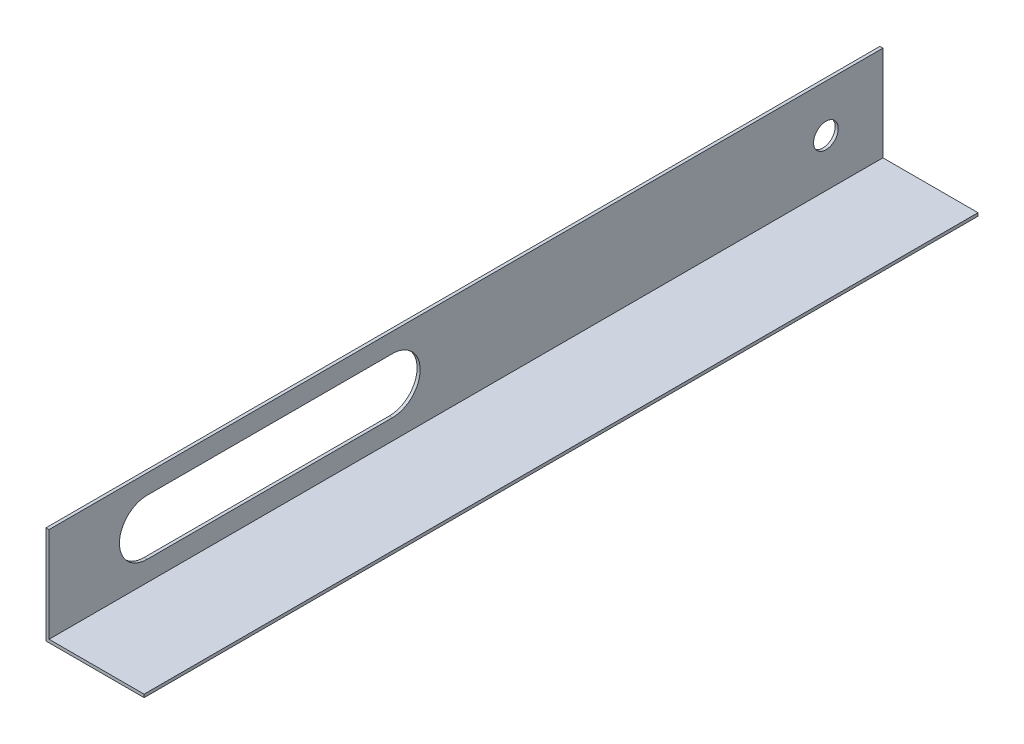
from build123d import *

# Parameters (mm, degrees)
BOSS_EXTRUDE2_DEPTH = 431.8
CUT_EXTRUDE3_DEPTH  = 127
SKETCH7_R           = 6.3881
CUT_EXTRUDE4_DEPTH  = 127


with BuildPart() as part:
    # Sketch3 → Boss-Extrude2 (new body)
    with BuildSketch(Plane.XY):
        Polygon((0, 0), (0, 49.2125), (-1.5875, 49.2125), (-1.5875, -1.5875), (49.2125, -1.5875), (49.2125, 0), align=None)
    extrude(amount=BOSS_EXTRUDE2_DEPTH)

    # Sketch6 → Cut-Extrude3 (cut)
    with BuildSketch(Plane(origin=(0, 0, 0), x_dir=(0, 0, -1), z_dir=(1, 0, 0))):
        with BuildLine():
            Line((-381, 39.1795), (-254, 39.1795))
            ThreePointArc((-254, 39.1795), (-239.649, 24.8285), (-254, 10.4775))
            Line((-254, 10.4775), (-381, 10.4775))
            ThreePointArc((-381, 10.4775), (-395.351, 24.8285), (-381, 39.1795))
        make_face()
    extrude(amount=-CUT_EXTRUDE3_DEPTH, mode=Mode.SUBTRACT)

    # Sketch7 → Cut-Extrude4 (cut)
    with BuildSketch(Plane(origin=(0, 0, 0), x_dir=(0, 0, -1), z_dir=(1, 0, 0))):
        with Locations((-29.538792285, 24.773594829)):
            Circle(SKETCH7_R)
    extrude(amount=-CUT_EXTRUDE4_DEPTH, mode=Mode.SUBTRACT)


solid = part.part
